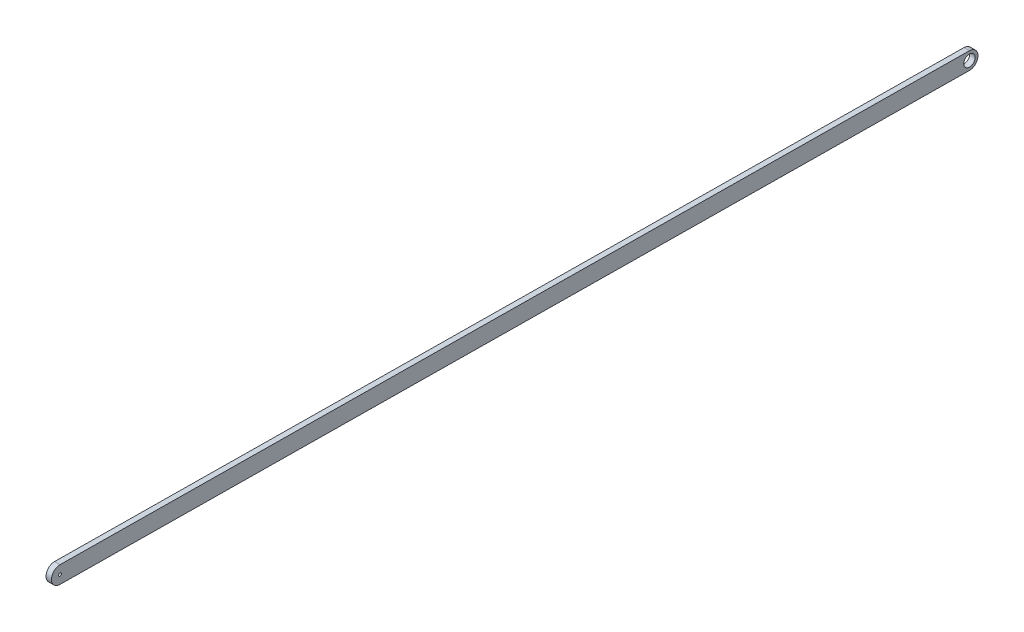
from build123d import *

# Parameters (mm, degrees)
SKETCH1_R           = 3.175
SKETCH1_R_2         = 0.79375
BOSS_EXTRUDE1_DEPTH = 3.03784


with BuildPart() as part:
    # Sketch1 → Boss-Extrude1 (new body)
    with BuildSketch(Plane(origin=(0, 0, 0), x_dir=(0, 0, -1), z_dir=(1, 0, 0))):
        with BuildLine():
            Line((-173.405335083, -4.762233996), (332.671176872, -10.111278831))
            ThreePointArc((332.671176872, -10.111278831), (337.483745951, -5.399379918), (332.771847038, -0.58681084))
            Line((332.771847038, -0.58681084), (-173.304664917, 4.762233996))
            ThreePointArc((-173.304664917, 4.762233996), (-178.117233996, 0.050335083), (-173.405335083, -4.762233996))
        make_face()
        with Locations((332.721511955, -5.349044835)):
            Circle(SKETCH1_R, mode=Mode.SUBTRACT)
        with Locations((-173.355, 0)):
            Circle(SKETCH1_R_2, mode=Mode.SUBTRACT)
    extrude(amount=BOSS_EXTRUDE1_DEPTH)


solid = part.part
